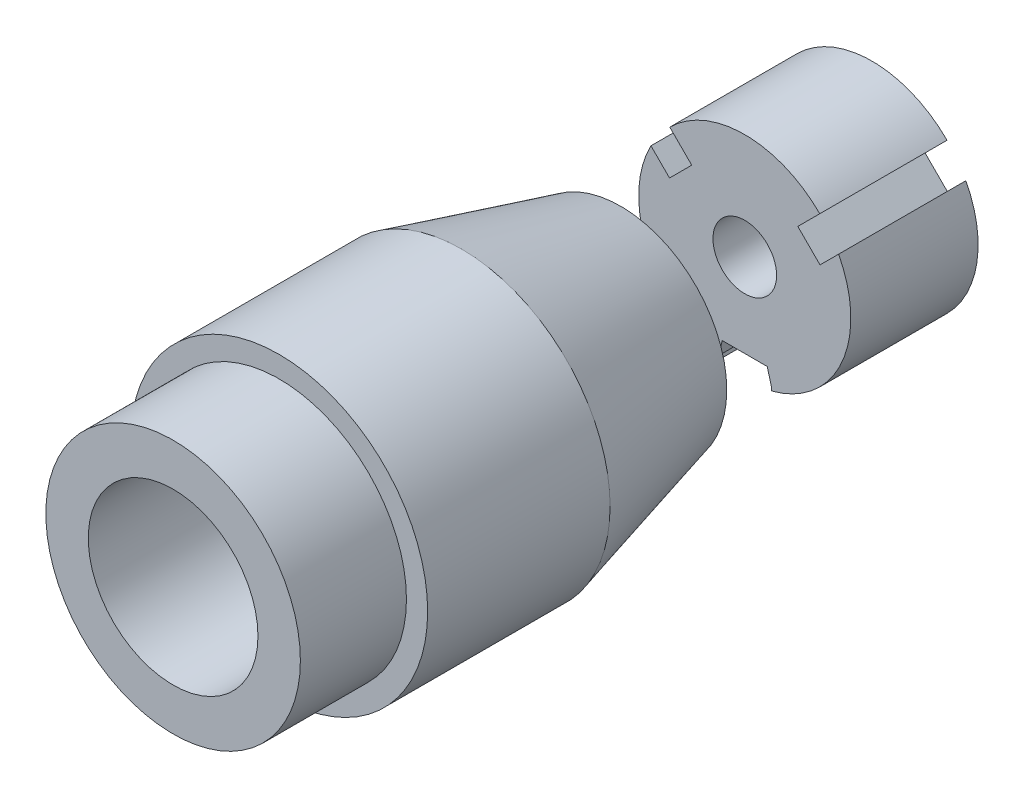
from build123d import *

# Parameters (mm, degrees)
BOSS_EXTRUDE2_DEPTH = 30
SKETCH2_R           = 7.5
CUT_EXTRUDE1_DEPTH  = 13
SKETCH5_R           = 25
SKETCH7_R           = 35
SKETCH10_R          = 35
BOSS_EXTRUDE3_DEPTH = 43
SKETCH11_R          = 30
BOSS_EXTRUDE4_DEPTH = 25
SHELL4_T            = -10
SHELL5_START        = 10
SHELL5_DEPTH        = 10


# Read off the part's stored shape, not the designer's step: Shell5
with BuildPart() as part:
    # Sketch1 → Boss-Extrude2 (new body)
    with BuildSketch(Plane.XY):
        with BuildLine():
            Line((-17.67766953, 17.67766953), (-12.5, 12.5))
            Line((-12.5, 12.5), (-17.737217669, 7.262782331))
            Line((-17.737217669, 7.262782331), (-22.121279713, 11.646844374))
            ThreePointArc((-22.121279713, 11.646844374), (-22.864843942, -10.10934773), (-6.271925609, -24.200474151))
            Line((-6.271925609, -24.200474151), (-6.271925609, -23.312629151))
            Line((-6.271925609, -23.312629151), (-5.3, -19.7))
            Line((-5.3, -19.7), (0, -19.7))
            Line((0, -19.7), (5.3, -19.7))
            Line((5.3, -19.7), (6.271925609, -23.312629151))
            Line((6.271925609, -23.312629151), (6.271925609, -24.200474151))
            ThreePointArc((6.271925609, -24.200474151), (19.771167647, -15.300357182), (25, 0))
            ThreePointArc((25, 0), (24.269651757, 5.998666818), (22.121279713, 11.646844374))
            Line((22.121279713, 11.646844374), (17.737217669, 7.262782331))
            Line((17.737217669, 7.262782331), (12.5, 12.5))
            Line((12.5, 12.5), (17.67766953, 17.67766953))
            ThreePointArc((17.67766953, 17.67766953), (0, 25), (-17.67766953, 17.67766953))
        make_face()
    extrude(amount=BOSS_EXTRUDE2_DEPTH)

    # Sketch2 → Cut-Extrude1 (cut)
    with BuildSketch(Plane.XY.offset(30)):
        Circle(SKETCH2_R)
    extrude(amount=-CUT_EXTRUDE1_DEPTH, mode=Mode.SUBTRACT)

    # Shell5 outline → Shell5 (cut)
    with BuildSketch(Plane.XY.offset(SHELL5_START)):
        with BuildLine():
            Line((0, 14.142135624), (0.834626339, 14.976761962))
            ThreePointArc((0.834626339, 14.976761962), (0, 15), (-0.834626339, 14.976761962))
            Line((-0.834626339, 14.976761962), (0, 14.142135624))
        make_face()
    extrude(amount=SHELL5_DEPTH, mode=Mode.SUBTRACT)


with BuildPart() as body_2:
    # Sketch5 → Loft1 section 0
    with BuildSketch(Plane.XY.offset(59.248809309)):
        Circle(SKETCH5_R)
    # Sketch7 → Loft1 section 1
    with BuildSketch(Plane.XY.offset(96.748809309)):
        Circle(SKETCH7_R)
    loft()

    # Sketch10 → Boss-Extrude3 (add)
    with BuildSketch(Plane.XY.offset(96.748809309)):
        Circle(SKETCH10_R)
    extrude(amount=BOSS_EXTRUDE3_DEPTH)

    # Sketch11 → Boss-Extrude4 (add)
    with BuildSketch(Plane.XY.offset(139.748809309)):
        Circle(SKETCH11_R)
    extrude(amount=BOSS_EXTRUDE4_DEPTH)

    # Shell4
    shell4_openings = [body_2.faces().sort_by_distance(p)[0] for p in [
        (0, 0, 164.748809309),
        (0, 0, 59.248809309),
    ]]
    offset(amount=SHELL4_T, openings=shell4_openings, kind=Kind.INTERSECTION)


solid = Compound([part.part, body_2.part])
